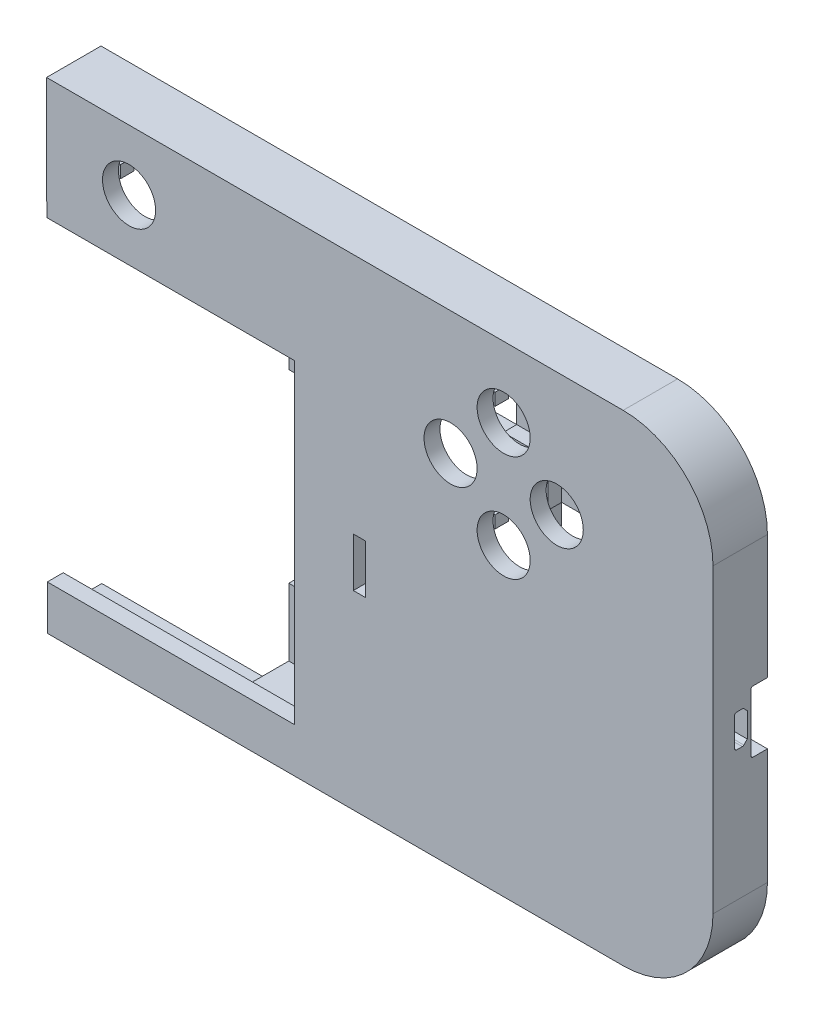
from build123d import *
from OCP.BRepAlgoAPI import BRepAlgoAPI_Cut
from OCP.TopTools import TopTools_ListOfShape

# Parameters (mm, degrees)
BOSS_EXTRUDE1_START     = 12
BOSS_EXTRUDE1_DEPTH     = 13.331287921
BOSS_EXTRUDE2_START     = 12
SKETCH1_3_W             = 121
SKETCH1_3_H             = 77.2
BOSS_EXTRUDE2_DEPTH     = 3.9
CUT_EXTRUDE1_START      = 12
SKETCH2_R               = 6.5
CUT_EXTRUDE1_DEPTH      = 3.9
CUT_EXTRUDE3_START      = 163.1
CUT_EXTRUDE3_DEPTH      = 3.9
CUT_EXTRUDE4_START      = 8.1
SKETCH5_W               = 70
SKETCH5_H               = 53.168839264
CUT_EXTRUDE4_DEPTH      = 1.8
BOSS_EXTRUDE3_START     = 8.1
BOSS_EXTRUDE3_DEPTH     = 15
BOSS_EXTRUDE4_START     = -6.9
SKETCH6_4_W             = 16.5
SKETCH6_4_H             = 16.5
SKETCH6_4_R             = 1.8
BOSS_EXTRUDE4_DEPTH     = 5
CUT_EXTRUDE5_START      = -59.9
SKETCH7_R               = 6.5
CUT_EXTRUDE5_DEPTH      = 3.9
BOSS_EXTRUDE7_START     = 8.1
SKETCH8_W               = 4
SKETCH8_H               = 3
SKETCH8_W_2             = 3
SKETCH8_H_2             = 4
SKETCH8_W_3             = 8
SKETCH8_H_3             = 4.95
BOSS_EXTRUDE7_DEPTH     = 3.3
BOSS_EXTRUDE8_START     = 4.8
SKETCH8_3_W             = 8
SKETCH8_3_H             = 5
SKETCH8_3_W_2           = 5
SKETCH8_3_H_2           = 8
SKETCH8_3_H_3           = 4
SKETCH8_3_H_4           = 4.95
BOSS_EXTRUDE8_DEPTH     = 3
BOSS_EXTRUDE9_START     = 9.9
SKETCH9_W               = 6.735111263
SKETCH9_H               = 18.572579543
SKETCH9_W_2             = 6.849276862
SKETCH9_H_2             = 17.65415528
BOSS_EXTRUDE9_DEPTH     = 5.88
BOSS_EXTRUDE10_START    = 8.1
SKETCH9_4_W             = 7.5
SKETCH9_4_H             = 39.329891822
BOSS_EXTRUDE10_DEPTH    = 4.88
CUT_EXTRUDE6_START      = 1.414648
SKETCH10_W              = 3
SKETCH10_H              = 12
CUT_EXTRUDE6_DEPTH      = 3.9
BOSS_EXTRUDE11_START    = -1.331288
SKETCH11_R              = 4
BOSS_EXTRUDE11_DEPTH    = 11.231288
CUT_EXTRUDE7_DEPTH      = 60
CUT_EXTRUDE7_DEPTH_BACK = 10


with BuildPart() as part:
    # Sketch1 → Boss-Extrude1 (new body)
    with BuildSketch(Plane.XY.offset(BOSS_EXTRUDE1_START)):
        with BuildLine():
            Line((-162.9, -37.9), (-162.9, 35.9))
            ThreePointArc((-162.9, 35.9), (-156.456349186, 51.456349186), (-140.9, 57.9))
            Line((-140.9, 57.9), (141.1, 57.9))
            ThreePointArc((141.1, 57.9), (156.656349186, 51.456349186), (163.1, 35.9))
            Line((163.1, 35.9), (163.1, -37.9))
            ThreePointArc((163.1, -37.9), (156.656349186, -53.456349186), (141.1, -59.9))
            Line((141.1, -59.9), (-140.9, -59.9))
            ThreePointArc((-140.9, -59.9), (-156.456349186, -53.456349186), (-162.9, -37.9))
        make_face()
        with BuildLine():
            Line((137.2, -56), (-137, -56))
            ThreePointArc((-137, -56), (-152.556349186, -49.556349186), (-159, -34))
            Line((-159, -34), (-159, 32))
            ThreePointArc((-159, 32), (-152.556349186, 47.556349186), (-137, 54))
            Line((-137, 54), (137.2, 54))
            ThreePointArc((137.2, 54), (152.756349186, 47.556349186), (159.2, 32))
            Line((159.2, 32), (159.2, -34))
            ThreePointArc((159.2, -34), (152.756349186, -49.556349186), (137.2, -56))
        make_face(mode=Mode.SUBTRACT)
    extrude(amount=-BOSS_EXTRUDE1_DEPTH)

    # Sketch1<3> → Boss-Extrude2 (add)
    with BuildSketch(Plane.XY.offset(BOSS_EXTRUDE2_START)):
        with BuildLine():
            ThreePointArc((-137, -56), (-152.556349186, -49.556349186), (-159, -34))
            Line((-159, -34), (-159, 32))
            ThreePointArc((-159, 32), (-152.556349186, 47.556349186), (-137, 54))
            Line((-137, 54), (137.2, 54))
            ThreePointArc((137.2, 54), (152.756349186, 47.556349186), (159.2, 32))
            Line((159.2, 32), (159.2, -34))
            ThreePointArc((159.2, -34), (152.756349186, -49.556349186), (137.2, -56))
            Line((137.2, -56), (-137, -56))
        make_face()
        with Locations((0.073350115, -10.4)):
            Rectangle(SKETCH1_3_W, SKETCH1_3_H, mode=Mode.SUBTRACT)
    extrude(amount=-BOSS_EXTRUDE2_DEPTH)

    # Sketch2 → Cut-Extrude1 (cut)
    with BuildSketch(Plane.XY.offset(CUT_EXTRUDE1_START)):
        with Locations((111.836675057, 14.644432636)):
            Circle(SKETCH2_R)
        with Locations((98.836675057, 27.644432636)):
            Circle(SKETCH2_R)
        with Locations((111.836675057, 40.644432636)):
            Circle(SKETCH2_R)
        with Locations((124.836675057, 27.644432636)):
            Circle(SKETCH2_R)
        with Locations((20.1, 43.05)):
            Circle(SKETCH2_R)
        with Locations((-111.663324943, -42.644432636)):
            Circle(SKETCH2_R)
        with Locations((-124.663324943, -29.644432636)):
            Circle(SKETCH2_R)
        with Locations((-98.663324943, -29.644432636)):
            Circle(SKETCH2_R)
        with Locations((-111.663324943, -16.644432636)):
            Circle(SKETCH2_R)
        with Locations((-19.9, 43.05)):
            Circle(SKETCH2_R)
    extrude(amount=-CUT_EXTRUDE1_DEPTH, mode=Mode.SUBTRACT)

    # Sketch4 → Cut-Extrude3 (cut)
    with BuildSketch(Plane(origin=(0, 0, 0), x_dir=(0, 0, -1), z_dir=(1, 0, 0)).offset(CUT_EXTRUDE3_START)):
        with BuildLine():
            Line((-6.205473314, -6), (-4.820792559, -6))
            ThreePointArc((-4.820792559, -6), (-4.623827102, -5.962796787), (-4.454001452, -5.856313365))
            Line((-4.454001452, -5.856313365), (-3.605473314, -5.007785228))
            Line((-3.605473314, -5.007785228), (-3.605473314, 1.007785228))
            Line((-3.605473314, 1.007785228), (-4.454001452, 1.856313365))
            ThreePointArc((-4.454001452, 1.856313365), (-4.623827102, 1.962796787), (-4.820792559, 2))
            Line((-4.820792559, 2), (-6.205473314, 2))
            ThreePointArc((-6.205473314, 2), (-6.559026705, 1.853553391), (-6.705473314, 1.5))
            Line((-6.705473314, 1.5), (-6.705473314, -5.5))
            ThreePointArc((-6.705473314, -5.5), (-6.559026705, -5.853553391), (-6.205473314, -6))
        make_face()
        with BuildLine():
            Line((-2.698712079, -9.05), (-2.698712079, 5.05))
            ThreePointArc((-2.698712079, 5.05), (-2.552265469, 5.403553391), (-2.198712079, 5.55))
            Line((-2.198712079, 5.55), (4.705469512, 5.55))
            ThreePointArc((4.705469512, 5.55), (5.059022903, 5.403553391), (5.205469512, 5.05))
            Line((5.205469512, 5.05), (5.205469512, -9.05))
            ThreePointArc((5.205469512, -9.05), (5.059022903, -9.403553391), (4.705469512, -9.55))
            Line((4.705469512, -9.55), (-2.198712079, -9.55))
            ThreePointArc((-2.198712079, -9.55), (-2.552265469, -9.403553391), (-2.698712079, -9.05))
        make_face()
    extrude(amount=-CUT_EXTRUDE3_DEPTH, mode=Mode.SUBTRACT)

    # Sketch5 → Cut-Extrude4 (cut)
    with BuildSketch(Plane.XY.offset(CUT_EXTRUDE4_START)):
        with Locations((115.058285802, -19.439852927)):
            Rectangle(SKETCH5_W, SKETCH5_H)
    extrude(amount=CUT_EXTRUDE4_DEPTH, mode=Mode.SUBTRACT)

    # Sketch6 → Boss-Extrude3 (add)
    with BuildSketch(Plane.XY.offset(BOSS_EXTRUDE3_START)):
        Polygon((45.323350115, 28.2), (61.823350115, 28.2), (61.823350115, 11.7), (67.823350115, 11.7), (67.823350115, 34.2), (45.323350115, 34.2), align=None)
        Polygon((-45.176649885, 28.2), (-45.176649885, 34.2), (-67.676649885, 34.2), (-67.676649885, 11.7), (-61.676649885, 11.7), (-61.676649885, 28.2), align=None)
        Polygon((-61.676649885, -50.1), (-61.676649885, -33.6), (-67.676649885, -33.6), (-67.676649885, -56.1), (-45.176649885, -56.1), (-45.176649885, -50.1), align=None)
        Polygon((67.823350115, -56.1), (67.823350115, -33.6), (61.823350115, -33.6), (61.823350115, -50.1), (45.323350115, -50.1), (45.323350115, -56.1), align=None)
    extrude(amount=-BOSS_EXTRUDE3_DEPTH)

    # Sketch6<4> → Boss-Extrude4 (add)
    # profile 1 of 4: a face of its own
    with BuildSketch(Plane.XY.offset(BOSS_EXTRUDE4_START)):
        with Locations((-53.426649885, 19.95)):
            Rectangle(SKETCH6_4_W, SKETCH6_4_H)
        with Locations((-56.426649885, 22.95)):
            Circle(SKETCH6_4_R, mode=Mode.SUBTRACT)
    # profile 2 of 4: a face of its own
    with BuildSketch(Plane.XY.offset(BOSS_EXTRUDE4_START)):
        with Locations((-53.426649885, -41.85)):
            Rectangle(SKETCH6_4_W, SKETCH6_4_H)
        with Locations((-56.426649885, -44.85)):
            Circle(SKETCH6_4_R, mode=Mode.SUBTRACT)
    # profile 3 of 4: a face of its own
    with BuildSketch(Plane.XY.offset(BOSS_EXTRUDE4_START)):
        with Locations((53.573350115, -41.85)):
            Rectangle(SKETCH6_4_W, SKETCH6_4_H)
        with Locations((56.573350115, -44.85)):
            Circle(SKETCH6_4_R, mode=Mode.SUBTRACT)
    # profile 4 of 4: a face of its own
    with BuildSketch(Plane.XY.offset(BOSS_EXTRUDE4_START)):
        with Locations((53.573350115, 19.95)):
            Rectangle(SKETCH6_4_W, SKETCH6_4_H)
        with Locations((56.573350115, 22.95)):
            Circle(SKETCH6_4_R, mode=Mode.SUBTRACT)
    extrude(amount=BOSS_EXTRUDE4_DEPTH)

    # Sketch7 → Cut-Extrude5 (cut)
    with BuildSketch(Plane(origin=(0, 0, 0), x_dir=(1, 0, 0), z_dir=(0, 1, 0)).offset(CUT_EXTRUDE5_START)):
        with Locations((-94.9, 4.665643961)):
            Circle(SKETCH7_R)
        with Locations((95.1, 4.665643961)):
            Circle(SKETCH7_R)
    extrude(amount=CUT_EXTRUDE5_DEPTH, mode=Mode.SUBTRACT)

    # Sketch8 → Boss-Extrude7 (add)
    with BuildSketch(Plane.XY.offset(BOSS_EXTRUDE7_START)):
        Polygon((118.836675057, 23.644432636), (118.836675057, 31.644432636), (115.836675057, 31.644432636), (115.836675057, 34.644432636), (107.836675057, 34.644432636), (107.836675057, 31.644432636), (104.836675057, 31.644432636), (104.836675057, 23.644432636), (107.836675057, 23.644432636), (107.836675057, 20.644432636), (115.836675057, 20.644432636), (115.836675057, 23.644432636), align=None)
        with Locations((103.836675057, 14.644432636)):
            Rectangle(SKETCH8_W, SKETCH8_H)
        with Locations((98.836675057, 35.644432636)):
            Rectangle(SKETCH8_W_2, SKETCH8_H_2)
        with Locations((103.836675057, 40.644432636)):
            Rectangle(SKETCH8_W, SKETCH8_H)
        with Locations((124.836675057, 35.644432636)):
            Rectangle(SKETCH8_W_2, SKETCH8_H_2)
        with Locations((-103.663324943, -42.644432636)):
            Rectangle(SKETCH8_W, SKETCH8_H)
        with Locations((-98.663324943, -21.644432636)):
            Rectangle(SKETCH8_W_2, SKETCH8_H_2)
        with Locations((-103.663324943, -16.644432636)):
            Rectangle(SKETCH8_W, SKETCH8_H)
        with Locations((-124.663324943, -21.644432636)):
            Rectangle(SKETCH8_W_2, SKETCH8_H_2)
        Polygon((-115.663324943, -22.644432636), (-115.663324943, -25.644432636), (-118.663324943, -25.644432636), (-118.663324943, -33.644432636), (-115.663324943, -33.644432636), (-115.663324943, -36.644432636), (-107.663324943, -36.644432636), (-107.663324943, -33.644432636), (-104.663324943, -33.644432636), (-104.663324943, -25.644432636), (-107.663324943, -25.644432636), (-107.663324943, -22.644432636), align=None)
        with Locations((-11.9, 43.05)):
            Rectangle(SKETCH8_W, SKETCH8_H)
        with Locations((12.1, 43.05)):
            Rectangle(SKETCH8_W, SKETCH8_H)
        with Locations((20.1, 51.525)):
            Rectangle(SKETCH8_W_3, SKETCH8_H_3)
        with Locations((-19.9, 51.525)):
            Rectangle(SKETCH8_W_3, SKETCH8_H_3)
    extrude(amount=-BOSS_EXTRUDE7_DEPTH)

    # Sketch8<3> → Boss-Extrude8 (add)
    with BuildSketch(Plane.XY.offset(BOSS_EXTRUDE8_START)):
        with Locations((111.836675057, 18.144432636)):
            Rectangle(SKETCH8_3_W, SKETCH8_3_H)
        with Locations((121.336675057, 27.644432636)):
            Rectangle(SKETCH8_3_W_2, SKETCH8_3_H_2)
        with Locations((102.336675057, 27.644432636)):
            Rectangle(SKETCH8_3_W_2, SKETCH8_3_H_2)
        with Locations((111.836675057, 37.144432636)):
            Rectangle(SKETCH8_3_W, SKETCH8_3_H)
        Polygon((118.836675057, 23.644432636), (118.836675057, 31.644432636), (115.836675057, 31.644432636), (115.836675057, 34.644432636), (107.836675057, 34.644432636), (107.836675057, 31.644432636), (104.836675057, 31.644432636), (104.836675057, 23.644432636), (107.836675057, 23.644432636), (107.836675057, 20.644432636), (115.836675057, 20.644432636), (115.836675057, 23.644432636), align=None)
        with Locations((-121.163324943, -29.644432636)):
            Rectangle(SKETCH8_3_W_2, SKETCH8_3_H_2)
        with Locations((-102.163324943, -29.644432636)):
            Rectangle(SKETCH8_3_W_2, SKETCH8_3_H_2)
        with Locations((-111.663324943, -39.144432636)):
            Rectangle(SKETCH8_3_W, SKETCH8_3_H)
        with Locations((-111.663324943, -20.144432636)):
            Rectangle(SKETCH8_3_W, SKETCH8_3_H)
        Polygon((-115.663324943, -22.644432636), (-115.663324943, -25.644432636), (-118.663324943, -25.644432636), (-118.663324943, -33.644432636), (-115.663324943, -33.644432636), (-115.663324943, -36.644432636), (-107.663324943, -36.644432636), (-107.663324943, -33.644432636), (-104.663324943, -33.644432636), (-104.663324943, -25.644432636), (-107.663324943, -25.644432636), (-107.663324943, -22.644432636), align=None)
        with Locations((-19.9, 47.05)):
            Rectangle(SKETCH8_3_W, SKETCH8_3_H_3)
        with Locations((-19.9, 51.525)):
            Rectangle(SKETCH8_3_W, SKETCH8_3_H_4)
        with Locations((20.1, 47.05)):
            Rectangle(SKETCH8_3_W, SKETCH8_3_H_3)
        with Locations((20.1, 51.525)):
            Rectangle(SKETCH8_3_W, SKETCH8_3_H_4)
    extrude(amount=-BOSS_EXTRUDE8_DEPTH)

    # Sketch9 → Boss-Extrude9 (add)
    with BuildSketch(Plane.XY.offset(BOSS_EXTRUDE9_START)):
        with Locations((80.09191074, 4.460146993)):
            Rectangle(SKETCH9_W, SKETCH9_H)
        with Locations((155.775361569, -15.388021805)):
            Rectangle(SKETCH9_W_2, SKETCH9_H_2)
    extrude(amount=-BOSS_EXTRUDE9_DEPTH)

    # Sketch9<4> → Boss-Extrude10 (add)
    with BuildSketch(Plane.XY.offset(BOSS_EXTRUDE10_START)):
        with Locations((71.573350115, -25.185054089)):
            Rectangle(SKETCH9_4_W, SKETCH9_4_H)
    extrude(amount=-BOSS_EXTRUDE10_DEPTH)


with BuildPart() as cut_extrude6_tool:
    # Sketch10 → Cut-Extrude6 (new body)
    with BuildSketch(Plane(origin=(0.073350115, -1, 10.585352353), x_dir=(1, 0, 0), z_dir=(0, 0, 1)).offset(CUT_EXTRUDE6_START)):
        with Locations((76.448833599, -6.358991056)):
            Rectangle(SKETCH10_W, SKETCH10_H)
    extrude(amount=-CUT_EXTRUDE6_DEPTH)


with BuildPart() as part_1:
    add(part.part)

    # Cut-Extrude6: cut by cut_extrude6_tool, with a tolerance
    cut_extrude6_stock = TopTools_ListOfShape()
    cut_extrude6_stock.Append(part_1.part.wrapped)
    cut_extrude6_tools = TopTools_ListOfShape()
    cut_extrude6_tools.Append(cut_extrude6_tool.part.wrapped)
    cut_extrude6_cut = BRepAlgoAPI_Cut()
    cut_extrude6_cut.SetArguments(cut_extrude6_stock)
    cut_extrude6_cut.SetTools(cut_extrude6_tools)
    cut_extrude6_cut.SetFuzzyValue(0.00001)
    cut_extrude6_cut.Build()
    add(Compound.cast(cut_extrude6_cut.Shape()).solids(), mode=Mode.REPLACE)

    # Sketch11 → Boss-Extrude11 (add)
    # profile 1 of 4: a face of its own
    with BuildSketch(Plane.XY.offset(BOSS_EXTRUDE11_START)):
        with BuildLine():
            ThreePointArc((-159, -34), (-152.556349186, -49.556349186), (-137, -56))
            Line((-137, -56), (-137, -49))
            ThreePointArc((-137, -49), (-141.393398282, -38.393398282), (-152, -34))
            Line((-152, -34), (-159, -34))
        make_face()
        with Locations((-146.728174593, -43.728174593)):
            Circle(SKETCH11_R, mode=Mode.SUBTRACT)
    # profile 2 of 4: a face of its own
    with BuildSketch(Plane.XY.offset(BOSS_EXTRUDE11_START)):
        with BuildLine():
            Line((137.2, -49), (137.2, -56))
            ThreePointArc((137.2, -56), (152.756349186, -49.556349186), (159.2, -34))
            Line((159.2, -34), (152.2, -34))
            ThreePointArc((152.2, -34), (141.593398282, -38.393398282), (137.2, -49))
        make_face()
        with Locations((146.728174593, -43.728174593)):
            Circle(SKETCH11_R, mode=Mode.SUBTRACT)
    # profile 3 of 4: a face of its own
    with BuildSketch(Plane.XY.offset(BOSS_EXTRUDE11_START)):
        with BuildLine():
            ThreePointArc((-137, 54), (-152.556349186, 47.556349186), (-159, 32))
            Line((-159, 32), (-152, 32))
            ThreePointArc((-152, 32), (-141.393398282, 36.393398282), (-137, 47))
            Line((-137, 47), (-137, 54))
        make_face()
        with Locations((-146.728174593, 41.728174593)):
            Circle(SKETCH11_R, mode=Mode.SUBTRACT)
    # profile 4 of 4: a face of its own
    with BuildSketch(Plane.XY.offset(BOSS_EXTRUDE11_START)):
        with BuildLine():
            ThreePointArc((137.2, 47), (141.593398282, 36.393398282), (152.2, 32))
            Line((152.2, 32), (159.2, 32))
            ThreePointArc((159.2, 32), (152.756349186, 47.556349186), (137.2, 54))
            Line((137.2, 54), (137.2, 47))
        make_face()
        with Locations((146.728174593, 41.728174593)):
            Circle(SKETCH11_R, mode=Mode.SUBTRACT)
    extrude(amount=BOSS_EXTRUDE11_DEPTH)

    # Sketch12 → Cut-Extrude7 (cut, two sides: drawn at the far end of the back side and taken through both)
    with BuildSketch(Plane.XY.offset(-CUT_EXTRUDE7_DEPTH_BACK)):
        Polygon((-0.1, 59.9), (0.1, -59.9), (-174.604438732, -59.9), (-174.604438732, 59.9), align=None)
    extrude(amount=CUT_EXTRUDE7_DEPTH + CUT_EXTRUDE7_DEPTH_BACK, mode=Mode.SUBTRACT)


solid = part_1.part
